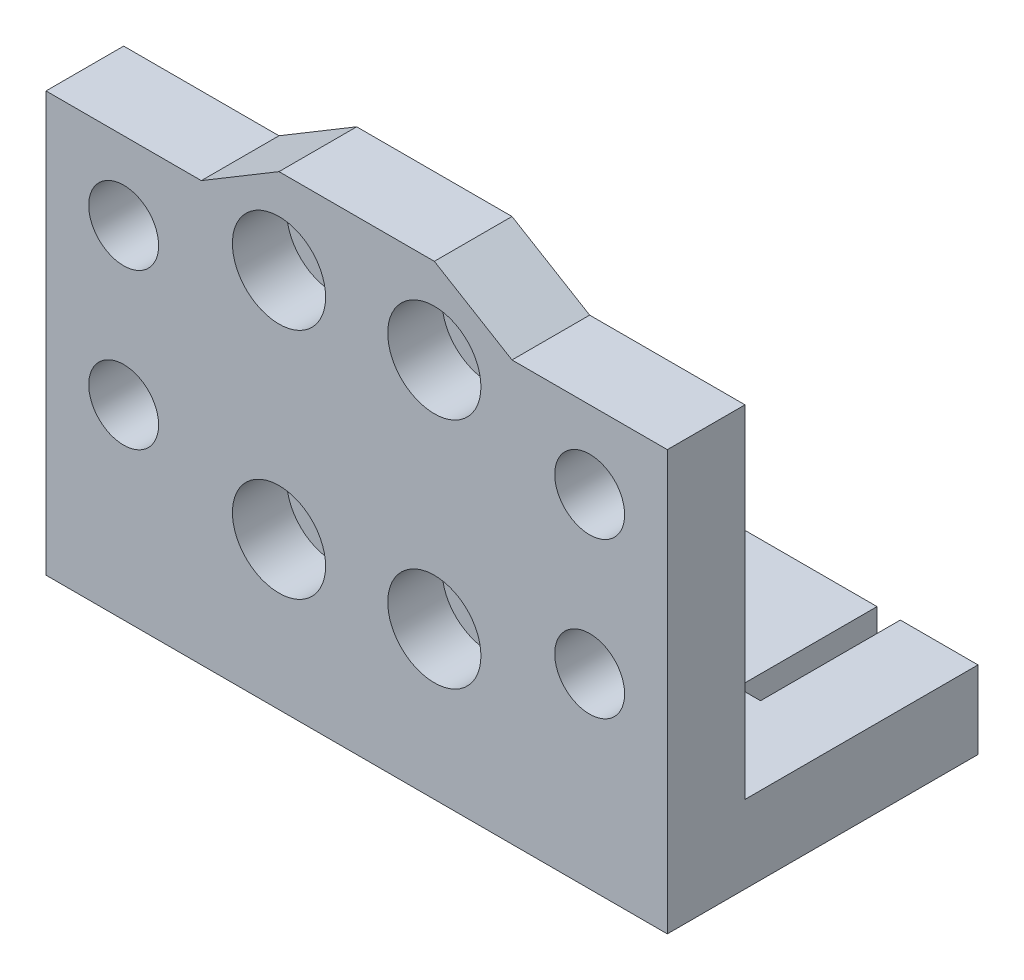
from build123d import *

# Parameters (mm, degrees)
SKETCH1_W           = 40
SKETCH1_H           = 27
BOSS_EXTRUDE1_DEPTH = 5
SKETCH2_W           = 40
SKETCH2_H           = 5
BOSS_EXTRUDE2_DEPTH = 15
SKETCH3_R           = 1.65
CUT_EXTRUDE1_DEPTH  = 15
BOSS_EXTRUDE3_DEPTH = 5
SKETCH5_R           = 3
CUT_EXTRUDE2_DEPTH  = 3.5
SKETCH6_W           = 1.5
SKETCH6_H           = 9
CUT_EXTRUDE3_DEPTH  = 5
SKETCH7_R           = 2.25
CUT_EXTRUDE4_DEPTH  = 5


with BuildPart() as part:
    # Sketch1 → Boss-Extrude1 (new body)
    with BuildSketch(Plane.XY):
        Rectangle(SKETCH1_W, SKETCH1_H)
    extrude(amount=BOSS_EXTRUDE1_DEPTH)

    # Sketch2 → Boss-Extrude2 (add)
    with BuildSketch(Plane(origin=(0, 0, 0), x_dir=(-1, 0, 0), z_dir=(0, 0, -1))):
        with Locations((0, -11)):
            Rectangle(SKETCH2_W, SKETCH2_H)
    extrude(amount=BOSS_EXTRUDE2_DEPTH)

    # Sketch3 → Cut-Extrude1 (cut)
    with BuildSketch(Plane.XY.offset(5)):
        with Locations((-5, 11)):
            Circle(SKETCH3_R)
        with Locations((5, 11)):
            Circle(SKETCH3_R)
        with Locations((5, -4)):
            Circle(SKETCH3_R)
        with Locations((-5, -4)):
            Circle(SKETCH3_R)
    extrude(amount=-CUT_EXTRUDE1_DEPTH, mode=Mode.SUBTRACT)

    # Sketch4 → Boss-Extrude3 (add)
    with BuildSketch(Plane.XY.offset(5)):
        Polygon((-10, 13.5), (-5, 16.5), (5, 16.5), (10, 13.5), align=None)
    extrude(amount=-BOSS_EXTRUDE3_DEPTH)

    # Sketch5 → Cut-Extrude2 (cut)
    with BuildSketch(Plane.XY.offset(5)):
        with Locations((-5, 11)):
            Circle(SKETCH5_R)
        with Locations((5, 11)):
            Circle(SKETCH5_R)
        with Locations((5, -4)):
            Circle(SKETCH5_R)
        with Locations((-5, -4)):
            Circle(SKETCH5_R)
    extrude(amount=-CUT_EXTRUDE2_DEPTH, mode=Mode.SUBTRACT)

    # Sketch6 → Cut-Extrude3 (cut)
    with BuildSketch(Plane(origin=(0, -8.5, 0), x_dir=(1, 0, 0), z_dir=(0, 1, 0))):
        with Locations((-14.25, 10.5)):
            Rectangle(SKETCH6_W, SKETCH6_H)
        with Locations((14.25, 10.5)):
            Rectangle(SKETCH6_W, SKETCH6_H)
    extrude(amount=-CUT_EXTRUDE3_DEPTH, mode=Mode.SUBTRACT)

    # Sketch7 → Cut-Extrude4 (cut)
    with BuildSketch(Plane.XY.offset(5)):
        with Locations((-15, 8.5)):
            Circle(SKETCH7_R)
        with Locations((15, 8.5)):
            Circle(SKETCH7_R)
        with Locations((15, -1.5)):
            Circle(SKETCH7_R)
        with Locations((-15, -1.5)):
            Circle(SKETCH7_R)
    extrude(amount=-CUT_EXTRUDE4_DEPTH, mode=Mode.SUBTRACT)


solid = part.part
